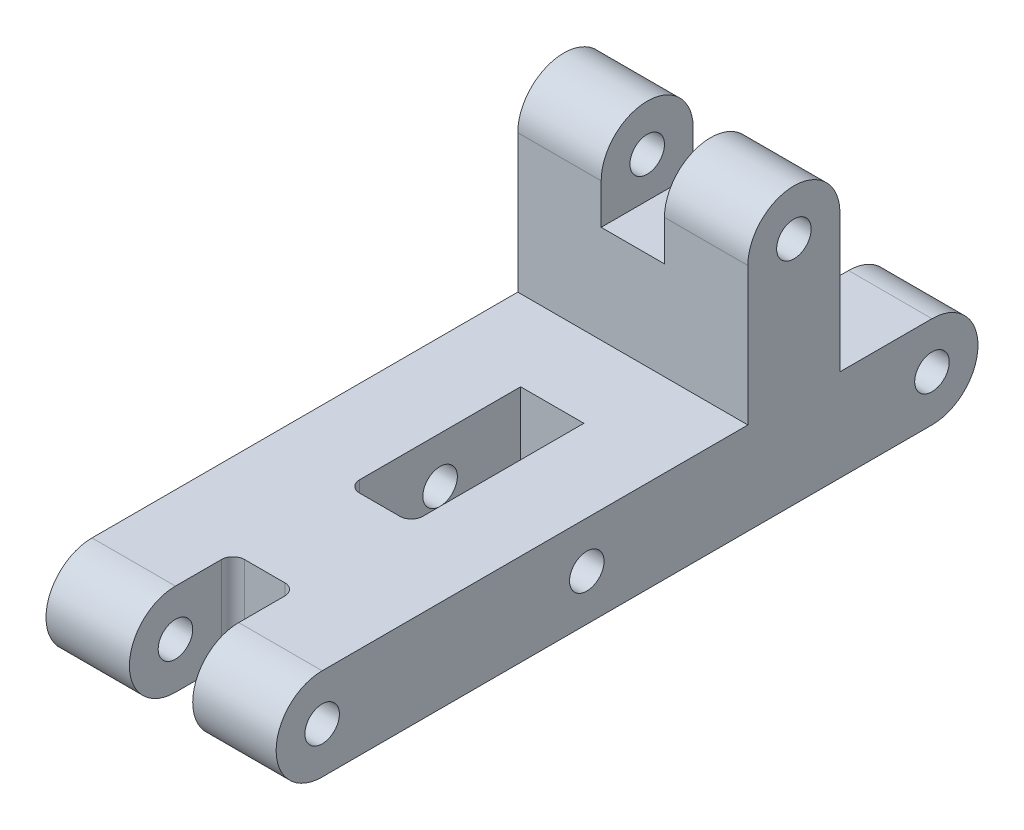
from build123d import *

# Parameters (mm, degrees)
CROQUIS1_R              = 1.5
SALIENTE_EXTRUIR1_DEPTH = 10
CROQUIS2_W              = 8
CROQUIS2_H              = 7.5
CROQUIS2_W_2            = 15
CROQUIS2_H_2            = 8
CROQUIS2_W_3            = 9
CORTAR_EXTRUIR1_DEPTH   = 2.75
REDONDEO1_R             = 1


with BuildPart() as part:
    # Croquis1 → Saliente-Extruir1 (new, symmetric)
    with BuildSketch(Plane(origin=(0, 0, 0), x_dir=(0, 0, -1), z_dir=(1, 0, 0))):
        with BuildLine():
            Line((-15, 4), (-1, 4))
            Line((-1, 4), (-1, 16))
            ThreePointArc((-1, 16), (3, 20), (7, 16))
            Line((7, 16), (7, 4))
            Line((7, 4), (15, 4))
            ThreePointArc((15, 4), (19, 0), (15, -4))
            Line((15, -4), (-15, -4))
            Line((-15, -4), (-38, -4))
            ThreePointArc((-38, -4), (-42, 0), (-38, 4))
            Line((-38, 4), (-15, 4))
        make_face()
        with Locations((15, 0)):
            Circle(CROQUIS1_R, mode=Mode.SUBTRACT)
        with Locations((3, 16)):
            Circle(CROQUIS1_R, mode=Mode.SUBTRACT)
        with Locations((-15, 0)):
            Circle(CROQUIS1_R, mode=Mode.SUBTRACT)
        with Locations((-38, 0)):
            Circle(CROQUIS1_R, mode=Mode.SUBTRACT)
    extrude(amount=SALIENTE_EXTRUIR1_DEPTH, both=True)

    # Croquis2 → Cortar-Extruir1 (cut, symmetric)
    with BuildSketch(Plane(origin=(0, 0, 0), x_dir=(0, 0, -1), z_dir=(1, 0, 0))):
        with Locations((3, 16.25)):
            Rectangle(CROQUIS2_W, CROQUIS2_H)
        with Locations((-15.5, 0)):
            Rectangle(CROQUIS2_W_2, CROQUIS2_H_2)
        with Locations((14.5, 0)):
            Rectangle(CROQUIS2_W_3, CROQUIS2_H_2)
        with Locations((-37.5, 0)):
            Rectangle(CROQUIS2_W_3, CROQUIS2_H_2)
    extrude(amount=CORTAR_EXTRUIR1_DEPTH, both=True, mode=Mode.SUBTRACT)

    # Redondeo1
    redondeo1_edges = [part.edges().sort_by_distance(p)[0] for p in [
        (2.75, 0, 23),
        (-2.75, 0, 23),
        (2.75, 0, 33),
        (-2.75, 0, 33),
        (2.75, 0, -10),
        (-2.75, 0, -10),
    ]]
    fillet(redondeo1_edges, radius=REDONDEO1_R)


solid = part.part
